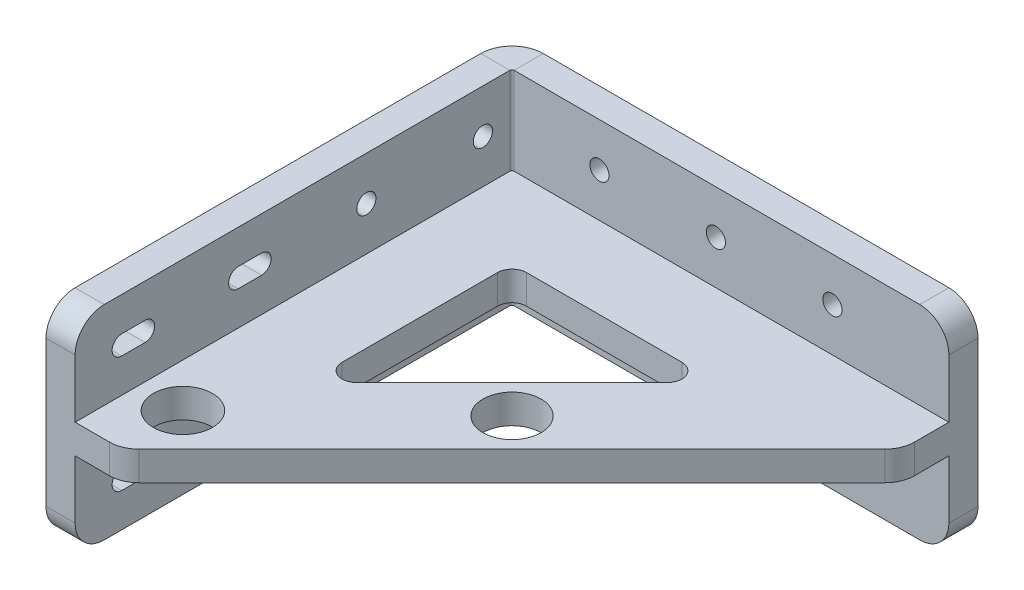
from build123d import *

# Parameters (mm, degrees)
SKETCH_1_W                       = 160
SKETCH_1_H                       = 70
SM_BASE_FLANGE_1_DEPTH           = 10
SM_EDGE_FLANGE_1_STRIP_W         = 41.4732
SM_EDGE_FLANGE_1_STRIP_H         = 10
SM_EDGE_FLANGE_1_STRIP_CUT_DEPTH = 70
SM_EDGE_FLANGE_1_DEPTH           = 70
EXTRUDE_1_DEPTH                  = 5
FILLET_1_R                       = 10
CUT_EXTRUDE_1_DEPTH              = 10
FILLET_2_R                       = 5
SKETCH_11_R                      = 3.3
CUT_EXTRUDE_2_DEPTH              = 10
SKETCH_12_R                      = 3.3
CUT_EXTRUDE_3_DEPTH              = 10
SKETCH_13_R                      = 10
SKETCH_13_R_2                    = 10.151646836
CUT_EXTRUDE_4_DEPTH              = 10


# Sheet-metal steps are written as plain solids
with BuildPart() as part:
    # Sketch 1 → 基体-法兰1 (new body)
    with BuildSketch(Plane.XY):
        Rectangle(SKETCH_1_W, SKETCH_1_H)
    extrude(amount=-SM_BASE_FLANGE_1_DEPTH)

    # 边线-法兰1 strip (across the edge) → 边线-法兰1 strip cut (cut)
    with BuildSketch(Plane(origin=(-80, 35, 0), x_dir=(1, 0, 0), z_dir=(0, -1, 0))):
        with Locations((-10, -5)):
            Rectangle(SM_EDGE_FLANGE_1_STRIP_W, SM_EDGE_FLANGE_1_STRIP_H)
    extrude(amount=SM_EDGE_FLANGE_1_STRIP_CUT_DEPTH, mode=Mode.SUBTRACT)

    # 边线-法兰1 section (across the edge) → 边线-法兰1 (add)
    with BuildSketch(Plane(origin=(-80, 35, 0), x_dir=(1, 0, 0), z_dir=(0, -1, 0))):
        with BuildLine():
            Line((0, 0.7366), (0, 150))
            Line((0, 150), (10, 150))
            Line((10, 150), (10, 0.7366))
            ThreePointArc((10, 0.7366), (10.215745145, 0.215745145), (10.7366, 0))
            Line((10.7366, 0), (10.7366, -10))
            ThreePointArc((10.7366, -10), (3.144677333, -6.855322667), (0, 0.7366))
        make_face()
    extrude(amount=SM_EDGE_FLANGE_1_DEPTH)

    # 草图9 → 凸台-拉伸1 (add, symmetric)
    with BuildSketch(Plane(origin=(0, 0, 0), x_dir=(1, 0, 0), z_dir=(0, 1, 0))):
        with BuildLine():
            Line((-70, -150), (-54, -150))
            Line((-54, -150), (80, -16))
            Line((80, -16), (80, 0))
            Line((80, 0), (-69.2634, 0))
            ThreePointArc((-69.2634, 0), (-69.784254855, -0.215745145), (-70, -0.7366))
            Line((-70, -0.7366), (-70, -150))
        make_face()
    extrude(amount=EXTRUDE_1_DEPTH, both=True)

    # 圆角1
    fillet_1_edges = [part.edges().sort_by_distance(p)[0] for p in [
        (-75, 35, 150),
        (-75, -35, 150),
        (-54, 0, 150),
        (80, 0, 16),
        (80, -35, -5),
        (80, 35, -5),
    ]]
    fillet(fillet_1_edges, radius=FILLET_1_R)

    # 草图10 → 切除-拉伸1 (cut)
    with BuildSketch(Plane(origin=(0, 5, 0), x_dir=(1, 0, 0), z_dir=(0, 1, 0))):
        Polygon((-42, -98.402020254), (28.402020254, -28), (-42, -28), align=None)
    extrude(amount=-CUT_EXTRUDE_1_DEPTH, mode=Mode.SUBTRACT)

    # 圆角2
    fillet_2_edges = [part.edges().sort_by_distance(p)[0] for p in [
        (-42, 0, 98.402020254),
        (-42, 0, 28),
        (28.402020254, 0, 28),
    ]]
    fillet(fillet_2_edges, radius=FILLET_2_R)

    # 草图11 → 切除-拉伸2 (cut)
    with BuildSketch(Plane(origin=(-70, 0, 0), x_dir=(0, 0, -1), z_dir=(1, 0, 0))):
        with Locations((-50, 20)):
            Circle(SKETCH_11_R)
        with Locations((-10, 20)):
            Circle(SKETCH_11_R)
        with Locations((-10, -20)):
            Circle(SKETCH_11_R)
        with Locations((-50, -20)):
            Circle(SKETCH_11_R)
        with BuildLine():
            Line((-134, 23.3), (-126, 23.3))
            ThreePointArc((-126, 23.3), (-122.7, 20), (-126, 16.7))
            Line((-126, 16.7), (-134, 16.7))
            ThreePointArc((-134, 16.7), (-137.3, 20), (-134, 23.3))
        make_face()
        with BuildLine():
            Line((-86, 16.7), (-94, 16.7))
            ThreePointArc((-94, 16.7), (-97.3, 20), (-94, 23.3))
            Line((-94, 23.3), (-86, 23.3))
            ThreePointArc((-86, 23.3), (-82.7, 20), (-86, 16.7))
        make_face()
        with BuildLine():
            Line((-86, -23.3), (-94, -23.3))
            ThreePointArc((-94, -23.3), (-97.3, -20), (-94, -16.7))
            Line((-94, -16.7), (-86, -16.7))
            ThreePointArc((-86, -16.7), (-82.7, -20), (-86, -23.3))
        make_face()
        with BuildLine():
            Line((-126, -23.3), (-134, -23.3))
            ThreePointArc((-134, -23.3), (-137.3, -20), (-134, -16.7))
            Line((-134, -16.7), (-126, -16.7))
            ThreePointArc((-126, -16.7), (-122.7, -20), (-126, -23.3))
        make_face()
    extrude(amount=-CUT_EXTRUDE_2_DEPTH, mode=Mode.SUBTRACT)

    # 草图12 → 切除-拉伸3 (cut)
    with BuildSketch(Plane.XY):
        with Locations((-40, -20)):
            Circle(SKETCH_12_R)
        with Locations((-40, 20)):
            Circle(SKETCH_12_R)
        with Locations((40, 20)):
            Circle(SKETCH_12_R)
        with Locations((40, -20)):
            Circle(SKETCH_12_R)
        with Locations((0, -20)):
            Circle(SKETCH_12_R)
        with Locations((0, 20)):
            Circle(SKETCH_12_R)
    extrude(amount=-CUT_EXTRUDE_3_DEPTH, mode=Mode.SUBTRACT)

    # 草图13 → 切除-拉伸4 (cut)
    with BuildSketch(Plane(origin=(0, 5, 0), x_dir=(1, 0, 0), z_dir=(0, 1, 0))):
        with Locations(Location((3.100505063, -73.100505063, 0), (0, 0, 270))):
            Circle(SKETCH_13_R)
        with Locations(Location((-55, -128, 0), (0, 0, 270))):
            Circle(SKETCH_13_R_2)
    extrude(amount=-CUT_EXTRUDE_4_DEPTH, mode=Mode.SUBTRACT)


solid = part.part
